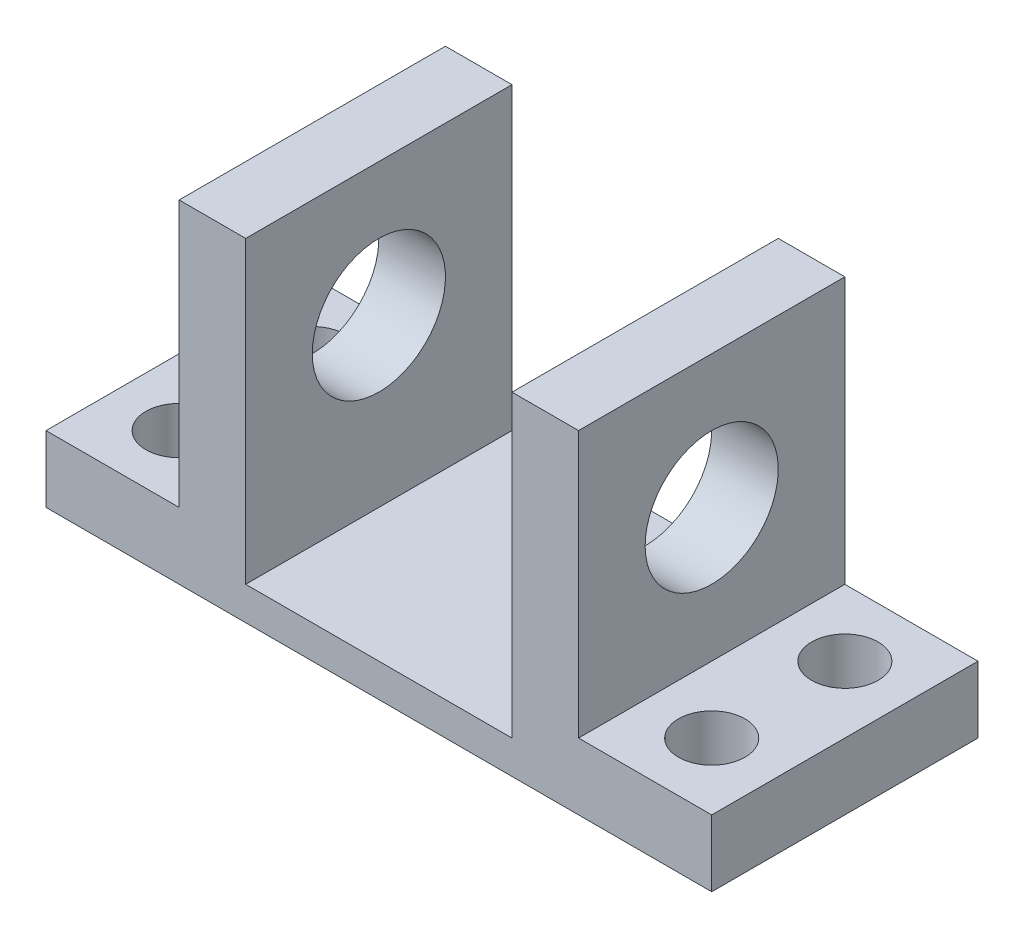
from build123d import *

# Parameters (mm, degrees)
SKETCH2_W                       = 6.35
SKETCH2_H                       = 25.4
BOSS_EXTRUDE1_DEPTH             = 31.75
BOSS_EXTRUDE1_2_DEPTH           = 31.75
SKETCH2_3_W                     = 25.4
SKETCH2_3_H                     = 25.4
BOSS_EXTRUDE2_DEPTH             = 3.175
SKETCH3_R                       = 6.35
CUT_EXTRUDE1_DEPTH              = 56.72102386
SKETCH4_W                       = 25.4
SKETCH4_H                       = 6.35
BOSS_EXTRUDE3_DEPTH             = 12.7
SKETCH9_W                       = 25.4
SKETCH9_H                       = 6.35
BOSS_EXTRUDE5_DEPTH             = 12.7
F_1_4_0_25_DIAMETER_HOLE1_D     = 6.35
F_1_4_0_25_DIAMETER_HOLE1_DEPTH = 25.4
F_1_4_0_25_DIAMETER_HOLE1_TIP   = 1.907732465


with BuildPart() as part:
    # Sketch2 → Boss-Extrude1 (new body)
    with BuildSketch(Plane(origin=(0, 0, 0), x_dir=(1, 0, 0), z_dir=(0, 1, 0))):
        with Locations((3.175, 12.7)):
            Rectangle(SKETCH2_W, SKETCH2_H)
    extrude(amount=BOSS_EXTRUDE1_DEPTH)



with BuildPart() as body_2:
    # Sketch2 → Boss-Extrude1 2 (new body)
    with BuildSketch(Plane(origin=(0, 0, 0), x_dir=(1, 0, 0), z_dir=(0, 1, 0))):
        with Locations((34.925, 12.7)):
            Rectangle(SKETCH2_W, SKETCH2_H)
    extrude(amount=BOSS_EXTRUDE1_2_DEPTH)


with BuildPart() as part_1:
    add(part.part)

    add(body_2.part)  # Boss-Extrude2 merges body 2
    # Sketch2<3> → Boss-Extrude2 (add)
    with BuildSketch(Plane(origin=(0, 0, 0), x_dir=(1, 0, 0), z_dir=(0, 1, 0))):
        with Locations((19.05, 12.7)):
            Rectangle(SKETCH2_3_W, SKETCH2_3_H)
    extrude(amount=BOSS_EXTRUDE2_DEPTH)

    # Sketch3 → Cut-Extrude1 (cut, through all)
    with BuildSketch(Plane.ZY):
        with Locations((-12.7, 19.05)):
            Circle(SKETCH3_R)
    extrude(amount=-CUT_EXTRUDE1_DEPTH, mode=Mode.SUBTRACT)

    # Sketch4 → Boss-Extrude3 (add)
    with BuildSketch(Plane.ZY):
        with Locations((-12.7, 3.175)):
            Rectangle(SKETCH4_W, SKETCH4_H)
    extrude(amount=BOSS_EXTRUDE3_DEPTH)

    # Sketch9 → Boss-Extrude5 (add)
    with BuildSketch(Plane(origin=(38.1, 0, 0), x_dir=(0, 0, -1), z_dir=(1, 0, 0))):
        with Locations((12.7, 3.175)):
            Rectangle(SKETCH9_W, SKETCH9_H)
    extrude(amount=BOSS_EXTRUDE5_DEPTH)

    # 1/4 (0.25) Diameter Hole1
    with Locations(Plane(origin=(-6.35, 6.35, -19.05), x_dir=(0, 0, 1), z_dir=(0, 1, 0))):
        with Locations((0, 0), (12.7, 0), (12.7, 50.8), (0, 50.8)):
            Hole(F_1_4_0_25_DIAMETER_HOLE1_D / 2, depth=F_1_4_0_25_DIAMETER_HOLE1_DEPTH)
            with Locations((0, 0, -(F_1_4_0_25_DIAMETER_HOLE1_DEPTH + F_1_4_0_25_DIAMETER_HOLE1_TIP / 2))):  # 118° drill point
                Cone(0, F_1_4_0_25_DIAMETER_HOLE1_D / 2, F_1_4_0_25_DIAMETER_HOLE1_TIP, mode=Mode.SUBTRACT)


solid = part_1.part
